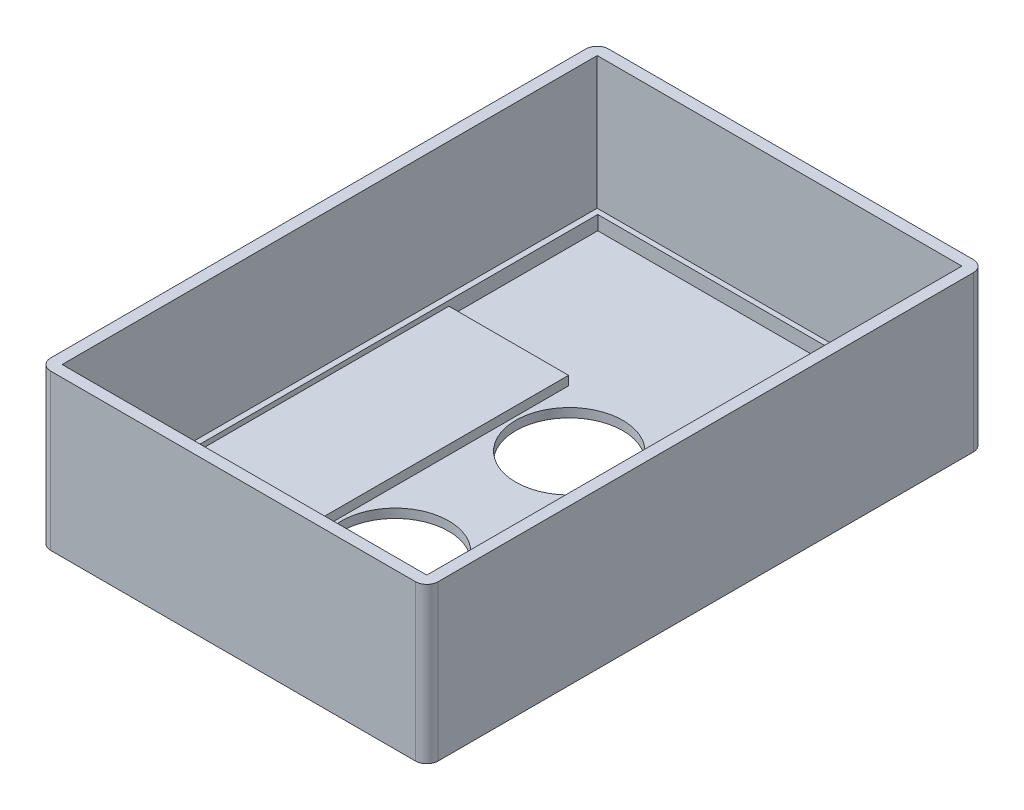
from build123d import *

# Parameters (mm, degrees)
SKETCH1_W           = 86.36
SKETCH1_H           = 124.333
BOSS_EXTRUDE1_DEPTH = 34.6202
SKETCH3_W           = 78.74
SKETCH3_H           = 116.84
CUT_EXTRUDE1_DEPTH  = 30.5816
SKETCH4_W           = 81.28
SKETCH4_H           = 119.253
CUT_EXTRUDE2_DEPTH  = 29.464
CUT_EXTRUDE3_DEPTH  = 2.032
SKETCH8_R           = 11.938
CUT_EXTRUDE4_DEPTH  = 2.032
FILLET1_R           = 2.54


with BuildPart() as part:
    # Sketch1 → Boss-Extrude1 (new body)
    with BuildSketch(Plane(origin=(0, 0, 0), x_dir=(1, 0, 0), z_dir=(0, 1, 0))):
        with Locations((43.18, 62.1665)):
            Rectangle(SKETCH1_W, SKETCH1_H)
    extrude(amount=BOSS_EXTRUDE1_DEPTH)

    # Sketch3 → Cut-Extrude1 (cut)
    with BuildSketch(Plane(origin=(0, 34.6202, 0), x_dir=(1, 0, 0), z_dir=(0, 1, 0))):
        with Locations((43.18, 62.23)):
            Rectangle(SKETCH3_W, SKETCH3_H)
    extrude(amount=-CUT_EXTRUDE1_DEPTH, mode=Mode.SUBTRACT)

    # Sketch4 → Cut-Extrude2 (cut)
    with BuildSketch(Plane(origin=(0, 34.6202, 0), x_dir=(1, 0, 0), z_dir=(0, 1, 0))):
        with Locations((43.18, 62.1665)):
            Rectangle(SKETCH4_W, SKETCH4_H)
    extrude(amount=-CUT_EXTRUDE2_DEPTH, mode=Mode.SUBTRACT)

    # Sketch6 → Cut-Extrude3 (cut)
    with BuildSketch(Plane(origin=(0, 4.0386, 0), x_dir=(1, 0, 0), z_dir=(0, 1, 0))):
        Polygon((3.81, 120.65), (82.55, 120.65), (82.55, 87.471955448), (55.88, 87.471955448), (55.88, 3.81), (30.48, 3.81), (30.48, 87.471955448), (3.81, 87.471955448), align=None)
    extrude(amount=-CUT_EXTRUDE3_DEPTH, mode=Mode.SUBTRACT)

    # Sketch8 → Cut-Extrude4 (cut)
    with BuildSketch(Plane(origin=(0, 2.0066, 0), x_dir=(1, 0, 0), z_dir=(0, 1, 0))):
        with Locations((43.18, 36.1188)):
            Circle(SKETCH8_R)
        with Locations((43.18, 74.93)):
            Circle(SKETCH8_R)
    extrude(amount=-CUT_EXTRUDE4_DEPTH, mode=Mode.SUBTRACT)

    # Fillet1
    fillet1_edges = [part.edges().sort_by_distance(p)[0] for p in [
        (86.36, 17.3101, 0),
        (0, 17.3101, 0),
        (0, 17.3101, -124.333),
        (86.36, 17.3101, -124.333),
    ]]
    fillet(fillet1_edges, radius=FILLET1_R)


solid = part.part
